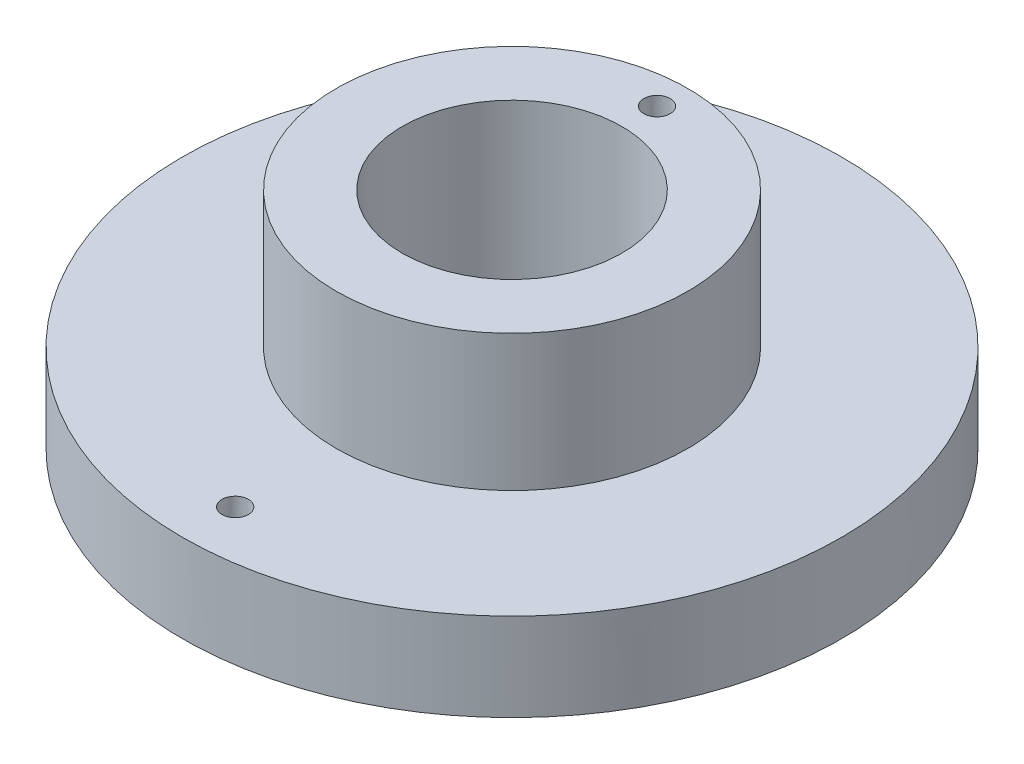
from build123d import *

# Parameters (mm, degrees)
EXTRUDE_1_DEPTH     = 8
SKETCH_2_R          = 37.5
SKETCH_2_R_2        = 1.5
EXTRUDE_2_DEPTH     = 10
SKETCH_3_R          = 20
EXTRUDE_3_DEPTH     = 15.5
SKETCH_4_R          = 12.5
CUT_EXTRUDE_1_DEPTH = 63.727585638
SKETCH_5_R          = 7.5
CUT_EXTRUDE_2_DEPTH = 4
FILLET_1_R          = 4
SKETCH_6_R          = 1.5
CUT_EXTRUDE_3_DEPTH = 5.5
SKETCH_9_R          = 1.5
CUT_EXTRUDE_4_DEPTH = 30
SKETCH_10_R         = 1.5
CUT_EXTRUDE_5_DEPTH = 25.5


with BuildPart() as part:
    # 草图1 → 凸台-拉伸1 (new body)
    with BuildSketch(Plane(origin=(0, 0, 0), x_dir=(1, 0, 0), z_dir=(0, 1, 0))):
        with BuildLine():
            Line((-20, 0), (-20, 31.721443851))
            ThreePointArc((-20, 31.721443851), (0, 37.5), (20, 31.721443851))
            Line((20, 31.721443851), (20, 0))
            ThreePointArc((20, 0), (0, -20), (-20, 0))
        make_face()
    extrude(amount=EXTRUDE_1_DEPTH)

    # 草图2 → 凸台-拉伸2 (add)
    with BuildSketch(Plane(origin=(0, 8, 0), x_dir=(1, 0, 0), z_dir=(0, 1, 0))):
        with Locations(Location((0, 0, 0), (0, 0, 122.230952636))):
            Circle(SKETCH_2_R)
        with Locations(Location((0, -31.5, 0), (0, 0, 270))):
            Circle(SKETCH_2_R_2, mode=Mode.SUBTRACT)
    extrude(amount=EXTRUDE_2_DEPTH)

    # 草图3 → 凸台-拉伸3 (add)
    with BuildSketch(Plane(origin=(0, 18, 0), x_dir=(1, 0, 0), z_dir=(0, 1, 0))):
        with Locations(Location((0, 0, 0), (0, 0, 270))):
            Circle(SKETCH_3_R)
    extrude(amount=EXTRUDE_3_DEPTH)

    # 草图4 → 切除-拉伸1 (cut, through all)
    with BuildSketch(Plane(origin=(0, 33.5, 0), x_dir=(1, 0, 0), z_dir=(0, 1, 0))):
        with Locations(Location((0, 0, 0), (0, 0, 270))):
            Circle(SKETCH_4_R)
    extrude(amount=-CUT_EXTRUDE_1_DEPTH, mode=Mode.SUBTRACT)

    # 草图5 → 切除-拉伸2 (cut)
    with BuildSketch(Plane.XZ):
        with Locations(Location((0, -28.5, 0), (0, 0, 270))):
            Circle(SKETCH_5_R)
    extrude(amount=-CUT_EXTRUDE_2_DEPTH, mode=Mode.SUBTRACT)

    # 圆角1
    fillet_1_edges = [part.edges().sort_by_distance(p)[0] for p in [
        (0, 4, -21),
    ]]
    fillet(fillet_1_edges, radius=FILLET_1_R - 0.0001)  # a hair under: the kernel refuses the full size

    # 草图6 → 切除-拉伸3 (cut)
    with BuildSketch(Plane.XZ.offset(-4)):
        with Locations(Location((0, -28.5, 0), (0, 0, 270))):
            Circle(SKETCH_6_R)
    extrude(amount=-CUT_EXTRUDE_3_DEPTH, mode=Mode.SUBTRACT)

    # 草图9 → 切除-拉伸4 (cut)
    with BuildSketch(Plane.XY):
        with Locations((0, 8)):
            Circle(SKETCH_9_R)
    extrude(amount=-CUT_EXTRUDE_4_DEPTH, mode=Mode.SUBTRACT)

    # 草图10 → 切除-拉伸5 (cut)
    with BuildSketch(Plane(origin=(0, 33.5, 0), x_dir=(1, 0, 0), z_dir=(0, 1, 0))):
        with Locations(Location((0, 16.5, 0), (0, 0, 270))):
            Circle(SKETCH_10_R)
    extrude(amount=-CUT_EXTRUDE_5_DEPTH, mode=Mode.SUBTRACT)


solid = part.part
